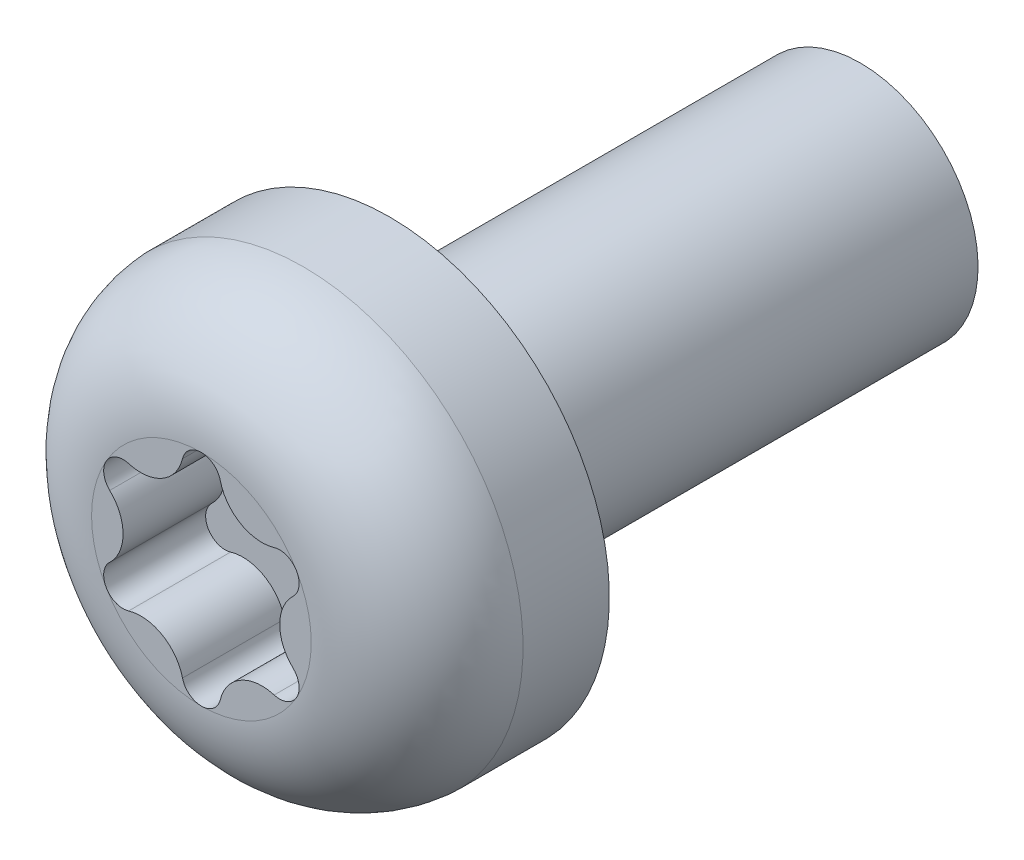
from build123d import *

# Parameters (mm, degrees)
ENL_V_MAT_EXTRU_1_DEPTH = 1.3


with BuildPart() as part:
    # Esquisse1 → Révolution1 (revolve)
    with BuildSketch(Plane(origin=(0, 0, 0), x_dir=(0, 0, -1), z_dir=(1, 0, 0))):
        with BuildLine():
            Line((-2.4, 0), (-2.4, 1.4))
            ThreePointArc((-2.4, 1.4), (-2.024883171, 2.355248659), (-1.1, 2.8))
            Line((-1.1, 2.8), (0, 2.8))
            Line((0, 2.8), (0, 1.5))
            Line((0, 1.5), (6, 1.5))
            Line((6, 1.5), (6, 0))
            Line((6, 0), (-2.4, 0))
        make_face()
    revolve(axis=Axis((0, 0, 2.4), (0, 0, 1)))

    # Esquisse2 → Enlèv. mat.-Extru.1 (cut)
    with BuildSketch(Plane.XY.offset(2.4)):
        with BuildLine():
            ThreePointArc((-0.240728142, 1.210222096), (0, 1.4), (0.240728142, 1.210222096))
            ThreePointArc((0.240728142, 1.210222096), (0.499017901, 0.864324358), (0.927719008, 0.813587734))
            ThreePointArc((0.927719008, 0.813587734), (1.212435565, 0.7), (1.16844715, 0.396634361))
            ThreePointArc((1.16844715, 0.396634361), (0.998035801, 0), (1.16844715, -0.396634361))
            ThreePointArc((1.16844715, -0.396634361), (1.212435565, -0.7), (0.927719008, -0.813587734))
            ThreePointArc((0.927719008, -0.813587734), (0.499017901, -0.864324358), (0.240728142, -1.210222096))
            ThreePointArc((0.240728142, -1.210222096), (0, -1.4), (-0.240728142, -1.210222096))
            ThreePointArc((-0.240728142, -1.210222096), (-0.499017901, -0.864324358), (-0.927719008, -0.813587734))
            ThreePointArc((-0.927719008, -0.813587734), (-1.212435565, -0.7), (-1.16844715, -0.396634361))
            ThreePointArc((-1.16844715, -0.396634361), (-0.998035801, 0), (-1.16844715, 0.396634361))
            ThreePointArc((-1.16844715, 0.396634361), (-1.212435565, 0.7), (-0.927719008, 0.813587734))
            ThreePointArc((-0.927719008, 0.813587734), (-0.499017901, 0.864324358), (-0.240728142, 1.210222096))
        make_face()
    extrude(amount=-ENL_V_MAT_EXTRU_1_DEPTH, mode=Mode.SUBTRACT)


solid = part.part
